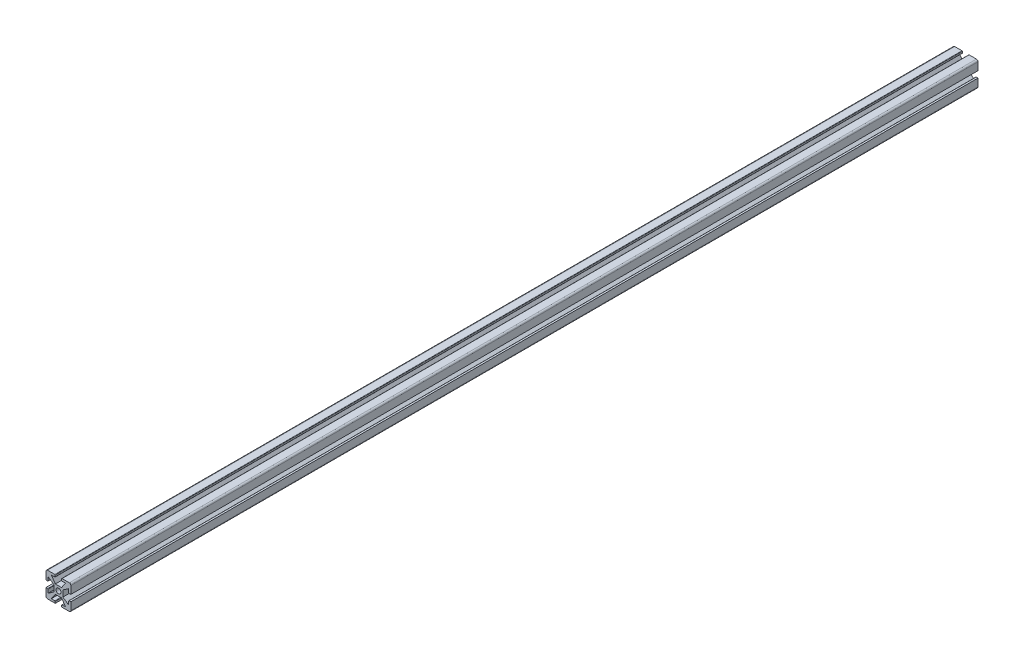
from build123d import *

# Parameters (mm, degrees)
SKETCH1_W           = 25.4
SKETCH1_H           = 25.4
BOSS_EXTRUDE1_DEPTH = 927.1
FILLET1_R           = 1.5875
HOLE1_OUTLINE_R     = 2.5527
HOLE1_DEPTH         = 927.1
SKETCH7_W           = 6.5278
SKETCH7_H           = 2.2352
CUT_EXTRUDE2_DEPTH  = 927.1
FILLET4_R           = 0.396875
CIRPATTERN2_DEPTH   = 927.1


# Read off the part's stored shape, not the designer's step: Hole1, CirPattern2
with BuildPart() as part:
    # Sketch1 → Boss-Extrude1 (new body)
    with BuildSketch(Plane.XY):
        Rectangle(SKETCH1_W, SKETCH1_H)
    extrude(amount=BOSS_EXTRUDE1_DEPTH)

    # Fillet1
    fillet1_edges = [part.edges().sort_by_distance(p)[0] for p in [
        (12.7, -12.7, 463.55),
        (-12.7, -12.7, 463.55),
        (-12.7, 12.7, 463.55),
        (12.7, 12.7, 463.55),
    ]]
    fillet(fillet1_edges, radius=FILLET1_R)

    # Hole1 outline → Hole1 (cut)
    with BuildSketch(Plane.XY):
        with Locations((0, -0.048792482)):
            Circle(HOLE1_OUTLINE_R)
    extrude(amount=HOLE1_DEPTH, mode=Mode.SUBTRACT)

    # Sketch7 → Cut-Extrude2 (cut)
    with BuildSketch(Plane.XY.offset(927.1)):
        with Locations((0, 11.5824)):
            Rectangle(SKETCH7_W, SKETCH7_H)
        Polygon((-3.175, 4.5212), (-7.3025, 10.4648), (7.3025, 10.4648), (3.175, 4.5212), align=None)
    extrude(amount=-CUT_EXTRUDE2_DEPTH, mode=Mode.SUBTRACT)

    # Fillet4
    fillet4_edges = [part.edges().sort_by_distance(p)[0] for p in [
        (-3.2639, 10.4648, 463.55),
        (-3.2639, 12.7, 463.55),
        (3.2639, 12.7, 463.55),
        (3.2639, 10.4648, 463.55),
    ]]
    fillet(fillet4_edges, radius=FILLET4_R)

    # CirPattern2 outline → CirPattern2 (cut)
    with BuildSketch(Plane.XY):
        with BuildLine():
            ThreePointArc((-3.660775, -10.562384964), (-3.380141996, -10.67862696), (-3.2639, -10.959259964))
            Line((-3.2639, -10.959259964), (-3.2639, -12.7))
            Line((-3.2639, -12.7), (3.2639, -12.7))
            Line((3.2639, -12.7), (3.2639, -10.959259964))
            ThreePointArc((3.2639, -10.959259964), (3.380141996, -10.67862696), (3.660775, -10.562384964))
            Line((3.660775, -10.562384964), (7.3025, -10.562384964))
            Line((7.3025, -10.562384964), (3.175, -4.618784964))
            Line((3.175, -4.618784964), (-3.175, -4.618784964))
            Line((-3.175, -4.618784964), (-7.3025, -10.562384964))
            Line((-7.3025, -10.562384964), (-3.660775, -10.562384964))
        make_face()
        with BuildLine():
            Line((-12.7, -3.312692482), (-10.910467482, -3.312692482))
            ThreePointArc((-10.910467482, -3.312692482), (-10.629834478, -3.428934478), (-10.513592482, -3.709567482))
            Line((-10.513592482, -3.709567482), (-10.513592482, -7.351292482))
            Line((-10.513592482, -7.351292482), (-4.569992482, -3.223792482))
            Line((-4.569992482, -3.223792482), (-4.569992482, 3.126207518))
            Line((-4.569992482, 3.126207518), (-10.513592482, 7.253707518))
            Line((-10.513592482, 7.253707518), (-10.513592482, 3.611982518))
            ThreePointArc((-10.513592482, 3.611982518), (-10.629834478, 3.331349514), (-10.910467482, 3.215107518))
            Line((-10.910467482, 3.215107518), (-12.7, 3.215107518))
            Line((-12.7, 3.215107518), (-12.7, -3.312692482))
        make_face()
        with BuildLine():
            ThreePointArc((10.513592482, -3.709567482), (10.629834478, -3.428934478), (10.910467482, -3.312692482))
            Line((10.910467482, -3.312692482), (12.7, -3.312692482))
            Line((12.7, -3.312692482), (12.7, 3.215107518))
            Line((12.7, 3.215107518), (10.910467482, 3.215107518))
            ThreePointArc((10.910467482, 3.215107518), (10.629834478, 3.331349514), (10.513592482, 3.611982518))
            Line((10.513592482, 3.611982518), (10.513592482, 7.253707518))
            Line((10.513592482, 7.253707518), (4.569992482, 3.126207518))
            Line((4.569992482, 3.126207518), (4.569992482, -3.223792482))
            Line((4.569992482, -3.223792482), (10.513592482, -7.351292482))
            Line((10.513592482, -7.351292482), (10.513592482, -3.709567482))
        make_face()
    extrude(amount=CIRPATTERN2_DEPTH, mode=Mode.SUBTRACT)


solid = part.part
